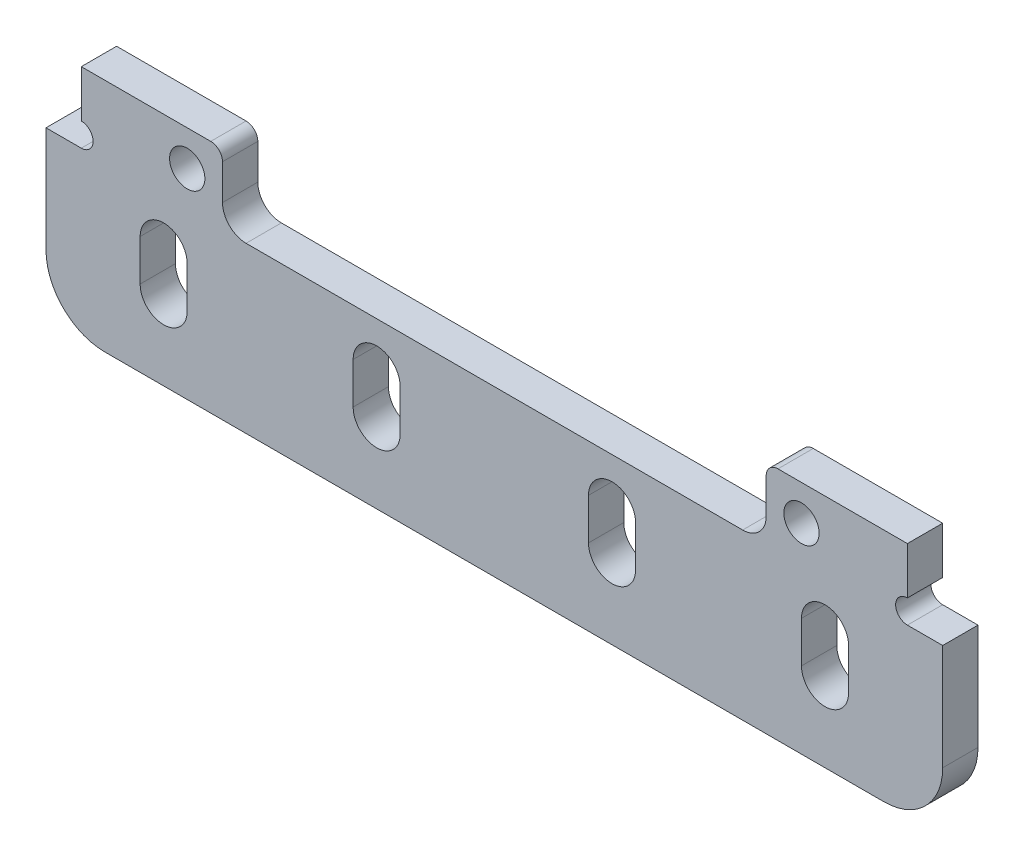
from build123d import *

# Parameters (mm, degrees)
EXTRUDE_1_DEPTH     = 3
FILLET_1_R          = 2
SKETCH_2_R          = 1.5
CUT_EXTRUDE_1_DEPTH = 10
FILLET_3_R          = 1
SKETCH_3_W          = 76.2
SKETCH_3_H          = 3
EXTRUDE_2_DEPTH     = 3
FILLET_4_R          = 5


# Read off the part's stored shape, not the designer's step: 凸台-拉伸1
with BuildPart() as part:
    # 凸台-拉伸1 outline → 凸台-拉伸1 (new body)
    with BuildSketch(Plane.XY):
        with BuildLine():
            Line((76.2, -17), (76.2, -6))
            Line((76.2, -6), (73.2, -6))
            ThreePointArc((73.2, -6), (72.2, -5), (73.2, -4))
            Line((73.2, -4), (73.2, 0))
            Line((73.2, 0), (61.2, 0))
            Line((61.2, 0), (61.2, -6))
            Line((61.2, -6), (15, -6))
            Line((15, -6), (15, 0))
            Line((15, 0), (3, 0))
            Line((3, 0), (3, -4))
            ThreePointArc((3, -4), (4, -5), (3, -6))
            Line((3, -6), (0, -6))
            Line((0, -6), (0, -17))
            Line((0, -17), (76.2, -17))
        make_face()
        with BuildLine():
            Line((12, -10), (12, -13.5))
            ThreePointArc((12, -13.5), (10, -15.5), (8, -13.5))
            Line((8, -13.5), (8, -10))
            ThreePointArc((8, -10), (10, -8), (12, -10))
        make_face(mode=Mode.SUBTRACT)
        with BuildLine():
            Line((26.1, -13.5), (26.1, -10))
            ThreePointArc((26.1, -10), (28.1, -8), (30.1, -10))
            Line((30.1, -10), (30.1, -13.5))
            ThreePointArc((30.1, -13.5), (28.1, -15.5), (26.1, -13.5))
        make_face(mode=Mode.SUBTRACT)
        with BuildLine():
            Line((46.1, -13.5), (46.1, -10))
            ThreePointArc((46.1, -10), (48.1, -8), (50.1, -10))
            Line((50.1, -10), (50.1, -13.5))
            ThreePointArc((50.1, -13.5), (48.1, -15.5), (46.1, -13.5))
        make_face(mode=Mode.SUBTRACT)
        with BuildLine():
            Line((68.2, -10), (68.2, -13.5))
            ThreePointArc((68.2, -13.5), (66.2, -15.5), (64.2, -13.5))
            Line((64.2, -13.5), (64.2, -10))
            ThreePointArc((64.2, -10), (66.2, -8), (68.2, -10))
        make_face(mode=Mode.SUBTRACT)
    extrude(amount=EXTRUDE_1_DEPTH)

    # 圆角1
    fillet_1_edges = [part.edges().sort_by_distance(p)[0] for p in [
        (15, -6, 1.5),
        (61.2, -6, 1.5),
    ]]
    fillet(fillet_1_edges, radius=FILLET_1_R)

    # 草图2 → 切除-拉伸1 (cut)
    with BuildSketch(Plane.XY.offset(3)):
        with Locations((12, -3)):
            Circle(SKETCH_2_R)
        with Locations((64.2, -3)):
            Circle(SKETCH_2_R)
    extrude(amount=-CUT_EXTRUDE_1_DEPTH, mode=Mode.SUBTRACT)

    # 圆角3
    fillet_3_edges = [part.edges().sort_by_distance(p)[0] for p in [
        (15, 0, 1.5),
        (61.2, 0, 1.5),
    ]]
    fillet(fillet_3_edges, radius=FILLET_3_R)

    # 草图3 → 凸台-拉伸2 (add)
    with BuildSketch(Plane.XZ.offset(17)):
        with Locations((38.1, 1.5)):
            Rectangle(SKETCH_3_W, SKETCH_3_H)
    extrude(amount=EXTRUDE_2_DEPTH)

    # 圆角4
    fillet_4_edges = [part.edges().sort_by_distance(p)[0] for p in [
        (0, -20, 1.5),
        (76.2, -20, 1.5),
    ]]
    fillet(fillet_4_edges, radius=FILLET_4_R)


solid = part.part
